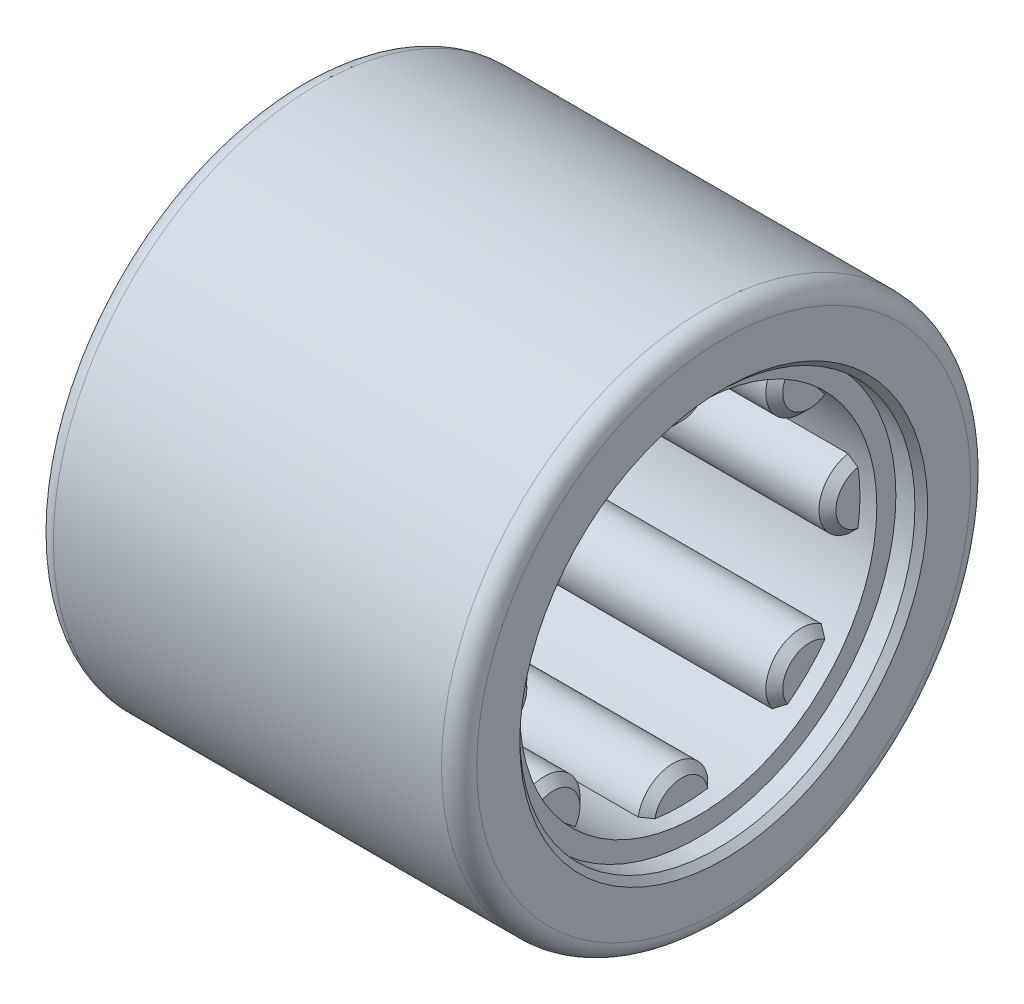
from build123d import *
from build123d.topology import SkipClean

# Parameters (mm, degrees)
CIRPATTERN2_COUNT  = 8
CIRPATTERN4_COUNT  = 8
SKETCH7_W          = 0.762
SKETCH7_H          = 1.163791667
CHAMFER1_SIZE      = 0.1905
SKETCH8_R          = 5.354666667
CUT_EXTRUDE2_DEPTH = 17.386691541


# Read off the part's stored shape, not the designer's step: DeleteFace2
with BuildPart() as part:
    # Sketch1 → Revolve1 (revolve)
    with BuildSketch(Plane.XY, mode=Mode.PRIVATE) as revolve1_sk:
        with BuildLine():
            Line((-6.35, 7.408333333), (-6.35, 4.7625))
            Line((-6.35, 4.7625), (-5.588, 4.7625))
            Line((-5.588, 4.7625), (-5.588, 6.879166667))
            Line((-5.588, 6.879166667), (-2.294466667, 6.879166667))
            Line((-2.294466667, 6.879166667), (-1.646766667, 6.879166667))
            Line((-1.646766667, 6.879166667), (1.646766667, 6.879166667))
            Line((1.646766667, 6.879166667), (2.294466667, 6.879166667))
            Line((2.294466667, 6.879166667), (5.588, 6.879166667))
            Line((5.588, 6.879166667), (5.588, 4.7625))
            Line((5.588, 4.7625), (6.35, 4.7625))
            Line((6.35, 4.7625), (6.35, 7.408333333))
            ThreePointArc((6.35, 7.408333333), (6.195010672, 7.782510672), (5.820833333, 7.9375))
            Line((5.820833333, 7.9375), (-5.820833333, 7.9375))
            ThreePointArc((-5.820833333, 7.9375), (-6.195010672, 7.782510672), (-6.35, 7.408333333))
        make_face()
    revolve(revolve1_sk.sketch.rotate(Axis((-6.35, 0, 0), (1, 0, 0)), 90), axis=Axis((-6.35, 0, 0), (1, 0, 0)))

    # Sketch7 → Cut-Revolve5 (revolve, cut)
    with BuildSketch(Plane.XY, mode=Mode.PRIVATE) as cut_revolve5_sk:
        with Locations((5.969, 5.344395834)):
            Rectangle(SKETCH7_W, SKETCH7_H)
    revolve(cut_revolve5_sk.sketch.rotate(Axis((-6.35, 0, 0), (1, 0, 0)), 90), axis=Axis((-6.35, 0, 0), (1, 0, 0)), mode=Mode.SUBTRACT)

    # Chamfer1
    chamfer1_edges = [part.edges().sort_by_distance(p)[0] for p in [
        (6.35, 0, -5.926291667),
    ]]
    chamfer(chamfer1_edges, length=CHAMFER1_SIZE)

    # Sketch8 → Cut-Extrude2 (cut, through all)
    with BuildSketch(Plane(origin=(-5.588, 0, 0), x_dir=(0, 0, -1), z_dir=(1, 0, 0))):
        Circle(SKETCH8_R)
    extrude(amount=-CUT_EXTRUDE2_DEPTH, mode=Mode.SUBTRACT)


with BuildPart() as body_2:
    # Sketch3 → Revolve3 (revolve)
    with BuildSketch(Plane.XY, mode=Mode.PRIVATE) as revolve3_sk:
        Polygon((-5.08, 5.439833333), (-5.08, 4.6355), (-4.826, 4.3815), (4.826, 4.3815), (5.08, 4.6355), (5.08, 5.439833333), align=None)
    revolve(revolve3_sk.sketch.rotate(Axis((-5.08, 5.439833333, 0), (1, 0, 0)), 270), axis=Axis((-5.08, 5.439833333, 0), (1, 0, 0)))


with BuildPart() as cirpattern2_1:
    # CirPattern2: pattern copy
    add(body_2.part.rotate(Axis((0, 0, 0), (1, 0, 0)), 1 * 360 / CIRPATTERN2_COUNT))


with BuildPart() as cirpattern2_2:
    # CirPattern2: pattern copy
    add(body_2.part.rotate(Axis((0, 0, 0), (1, 0, 0)), 2 * 360 / CIRPATTERN2_COUNT))


with BuildPart() as cirpattern2_3:
    # CirPattern2: pattern copy
    add(body_2.part.rotate(Axis((0, 0, 0), (1, 0, 0)), 3 * 360 / CIRPATTERN2_COUNT))


with BuildPart() as cirpattern2_4:
    # CirPattern2: pattern copy
    add(body_2.part.rotate(Axis((0, 0, 0), (1, 0, 0)), 4 * 360 / CIRPATTERN2_COUNT))


with BuildPart() as cirpattern2_5:
    # CirPattern2: pattern copy
    add(body_2.part.rotate(Axis((0, 0, 0), (1, 0, 0)), 5 * 360 / CIRPATTERN2_COUNT))


with BuildPart() as cirpattern2_6:
    # CirPattern2: pattern copy
    add(body_2.part.rotate(Axis((0, 0, 0), (1, 0, 0)), 6 * 360 / CIRPATTERN2_COUNT))


with BuildPart() as cirpattern2_7:
    # CirPattern2: pattern copy
    add(body_2.part.rotate(Axis((0, 0, 0), (1, 0, 0)), 7 * 360 / CIRPATTERN2_COUNT))


with BuildPart() as body_10:
    # Sketch5 → Revolve4 (revolve)
    with BuildSketch(Plane.XY, mode=Mode.PRIVATE) as revolve4_sk:
        Polygon((-5.588, 6.879166667), (-2.294466667, 6.879166667), (-1.646766667, 6.879166667), (1.646766667, 6.879166667), (2.294466667, 6.879166667), (5.588, 6.879166667), (5.588, 5.608666667), (5.334, 5.354666667), (0, 5.354666667), (-5.334, 5.354666667), (-5.588, 5.608666667), align=None)
    revolve(revolve4_sk.sketch.rotate(Axis((5.334, 0, 0), (1, 0, 0)), 270), axis=Axis((5.334, 0, 0), (1, 0, 0)))

    # Sketch3<3> → Cut-Revolve3 (revolve, cut)
    with BuildSketch(Plane.XY):
        Polygon((-5.08, 5.439833333), (-5.08, 4.6355), (-4.826, 4.3815), (4.826, 4.3815), (5.08, 4.6355), (5.08, 5.439833333), align=None)
    cut_revolve3 = revolve(axis=Axis((-5.08, 5.439833333, 0), (1, 0, 0)), mode=Mode.SUBTRACT)

    # CirPattern4: Cut-Revolve3 ×8 about axis
    cirpattern4_axis = Axis((0, 0, 0), (1, 0, 0))
    for i in range(1, CIRPATTERN4_COUNT):
        add(cut_revolve3.rotate(cirpattern4_axis, i * 360 / CIRPATTERN4_COUNT), mode=Mode.SUBTRACT)

    # DeleteFace2 outline → DeleteFace2 (revolve)
    with SkipClean():  # the faces are left unmerged after this step: merging them gives an invalid solid
        with BuildSketch(Plane.YX):
            Polygon((5.354666667, 5.588), (5.354666667, 5.334), (5.608666667, 5.588), align=None)
            Polygon((5.608666667, -5.588), (5.354666667, -5.334), (5.354666667, -5.588), align=None)
        revolve(axis=Axis((0, 0, 0), (1, 0, 0)))
    add(body_10.part.scale(1), mode=Mode.REPLACE)  # the faces are merged on a copy


solid = Compound([part.part, body_2.part, cirpattern2_1.part, cirpattern2_2.part, cirpattern2_3.part, cirpattern2_4.part, cirpattern2_5.part, cirpattern2_6.part, cirpattern2_7.part, body_10.part])
